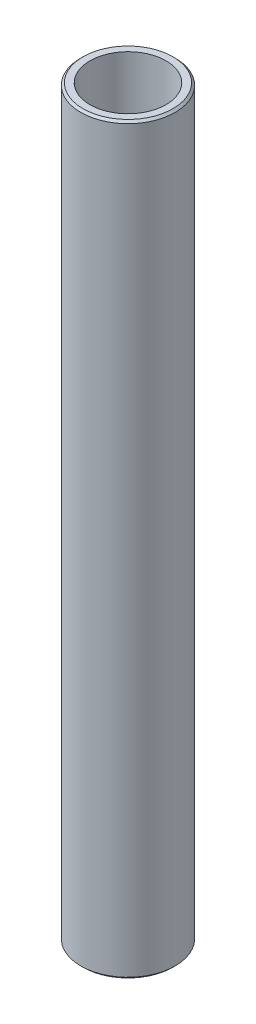
from build123d import *

# Parameters (mm, degrees)
SKETCH1_R           = 35
BOSS_EXTRUDE1_DEPTH = 551.971955137
SKETCH2_R           = 28.245071375
CUT_EXTRUDE1_DEPTH  = 555.186827034
CHAMFER1_SIZE       = 1.605646641


with BuildPart() as part:
    # Sketch1 → Boss-Extrude1 (new body)
    with BuildSketch(Plane(origin=(0, 0, 0), x_dir=(1, 0, 0), z_dir=(0, 1, 0))):
        Circle(SKETCH1_R)
    extrude(amount=BOSS_EXTRUDE1_DEPTH)

    # Sketch2 → Cut-Extrude1 (cut, through all)
    with BuildSketch(Plane(origin=(0, 0, 0), x_dir=(1, 0, 0), z_dir=(0, 1, 0))):
        Circle(SKETCH2_R)
    extrude(amount=CUT_EXTRUDE1_DEPTH, mode=Mode.SUBTRACT)

    # Chamfer1
    chamfer1_edges = [part.edges().sort_by_distance(p)[0] for p in [
        (-35, 551.971955137, 0),
        (-35, 0, 0),
    ]]
    chamfer(chamfer1_edges, length=CHAMFER1_SIZE)


solid = part.part
